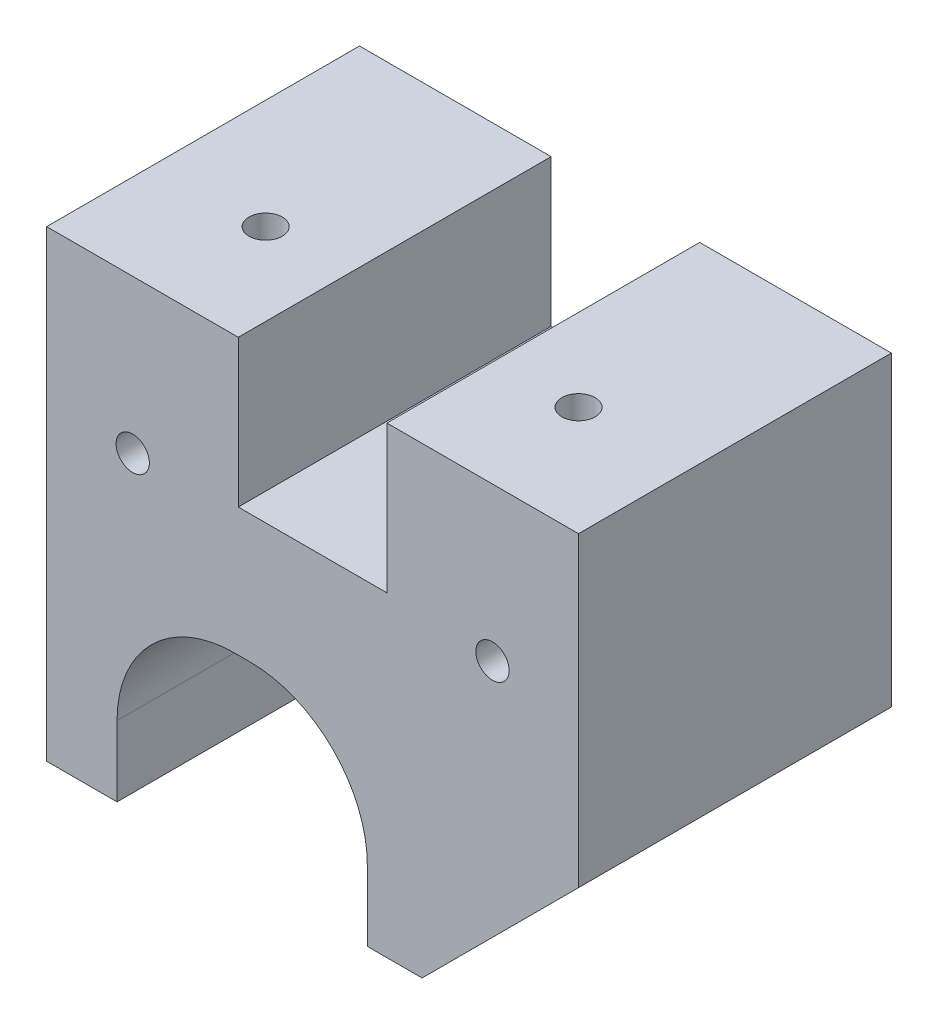
from build123d import *

# Parameters (mm, degrees)
SKETCH1_W                 = 43.18
SKETCH1_H                 = 25.4
BASE_DEPTH                = 37.592
SIDECHAMFER_SIZE          = 12.7
SKETCH2_W                 = 12.065
SKETCH2_H                 = 11.938
LINACTSLOT_DEPTH          = 51.24387091
MOUTINGHOLES_D            = 2.7051
MOUTINGHOLES_DEPTH        = 14.478
MOUTINGHOLES_TIP          = 0.81269403
MOTORSLOT_DEPTH           = 51.24387091
MOTORMOUNTINGHOLES2_D     = 2.2606
MOTORMOUNTINGHOLES2_DEPTH = 11.43
MOTORMOUNTINGHOLES2_TIP   = 0.679152758
F_6_32_TAPPED_HOLE1_D     = 2.7051
F_6_32_TAPPED_HOLE1_DEPTH = 7.62
F_6_32_TAPPED_HOLE1_TIP   = 0.81269403
CUT_EXTRUDE1_DEPTH        = 2.032


with BuildPart() as part:
    # Sketch1 → Base (new body)
    with BuildSketch(Plane(origin=(0, 0, 0), x_dir=(1, 0, 0), z_dir=(0, 1, 0))):
        Rectangle(SKETCH1_W, SKETCH1_H)
    extrude(amount=BASE_DEPTH)

    # SideChamfer
    sidechamfer_edges = [part.edges().sort_by_distance(p)[0] for p in [
        (21.59, 0, 0),
    ]]
    chamfer(sidechamfer_edges, length=SIDECHAMFER_SIZE)

    # Sketch2 → LinActSlot (cut, through all)
    with BuildSketch(Plane.XY.offset(12.7)):
        with Locations((0, 31.623)):
            Rectangle(SKETCH2_W, SKETCH2_H)
    extrude(amount=-LINACTSLOT_DEPTH, mode=Mode.SUBTRACT)

    # MoutingHoles
    with Locations(Plane(origin=(14.160350453, 37.592, 8.373414988), x_dir=(-1, 0, 0), z_dir=(0, 1, 0))):
        with Locations((1.460350453, -4.563414988), (26.860350453, -4.563414988)):
            Hole(MOUTINGHOLES_D / 2, depth=MOUTINGHOLES_DEPTH)
            with Locations((0, 0, -(MOUTINGHOLES_DEPTH + MOUTINGHOLES_TIP / 2))):  # 118° drill point
                Cone(0, MOUTINGHOLES_D / 2, MOUTINGHOLES_TIP, mode=Mode.SUBTRACT)

    # Sketch11 → MotorSlot (cut, through all)
    with BuildSketch(Plane(origin=(0, 0, -12.7), x_dir=(-1, 0, 0), z_dir=(0, 0, -1))):
        with BuildLine():
            Line((15.875, 5.08), (15.875, 5.715))
            ThreePointArc((15.875, 5.715), (13.085192091, 12.450192091), (6.35, 15.24))
            Line((6.35, 15.24), (5.08, 15.24))
            ThreePointArc((5.08, 15.24), (-1.655192091, 12.450192091), (-4.445, 5.715))
            Line((-4.445, 5.715), (-4.445, 5.08))
            Line((-4.445, 5.08), (-4.445, 0))
            Line((-4.445, 0), (15.875, 0))
            Line((15.875, 0), (15.875, 5.08))
        make_face()
    extrude(amount=-MOTORSLOT_DEPTH, mode=Mode.SUBTRACT)

    # MotorMountingHoles2
    with Locations(Plane(origin=(0, 0, -12.7), x_dir=(-1, 0, 0), z_dir=(0, 0, -1))):
        with Locations((18.215, 5.715), (-6.785, 5.715)):
            Hole(MOTORMOUNTINGHOLES2_D / 2, depth=MOTORMOUNTINGHOLES2_DEPTH)
            with Locations((0, 0, -(MOTORMOUNTINGHOLES2_DEPTH + MOTORMOUNTINGHOLES2_TIP / 2))):  # 118° drill point
                Cone(0, MOTORMOUNTINGHOLES2_D / 2, MOTORMOUNTINGHOLES2_TIP, mode=Mode.SUBTRACT)

    # #6-32 Tapped Hole1
    with Locations(Plane.XY.offset(12.7)):
        with Locations((-14.605, 25.146), (14.605, 25.146)):
            Hole(F_6_32_TAPPED_HOLE1_D / 2, depth=F_6_32_TAPPED_HOLE1_DEPTH)
            with Locations((0, 0, -(F_6_32_TAPPED_HOLE1_DEPTH + F_6_32_TAPPED_HOLE1_TIP / 2))):  # 118° drill point
                Cone(0, F_6_32_TAPPED_HOLE1_D / 2, F_6_32_TAPPED_HOLE1_TIP, mode=Mode.SUBTRACT)

    # Sketch23 → Cut-Extrude1 (cut)
    with BuildSketch(Plane(origin=(0, 0, -12.7), x_dir=(-1, 0, 0), z_dir=(0, 0, -1))):
        with BuildLine():
            Line((21.59, 2.54), (-21.59, 2.54))
            ThreePointArc((-21.59, 2.54), (-24.765, 5.715), (-21.59, 8.89))
            Line((-21.59, 8.89), (21.59, 8.89))
            ThreePointArc((21.59, 8.89), (24.765, 5.715), (21.59, 2.54))
        make_face()
    extrude(amount=-CUT_EXTRUDE1_DEPTH, mode=Mode.SUBTRACT)


solid = part.part
